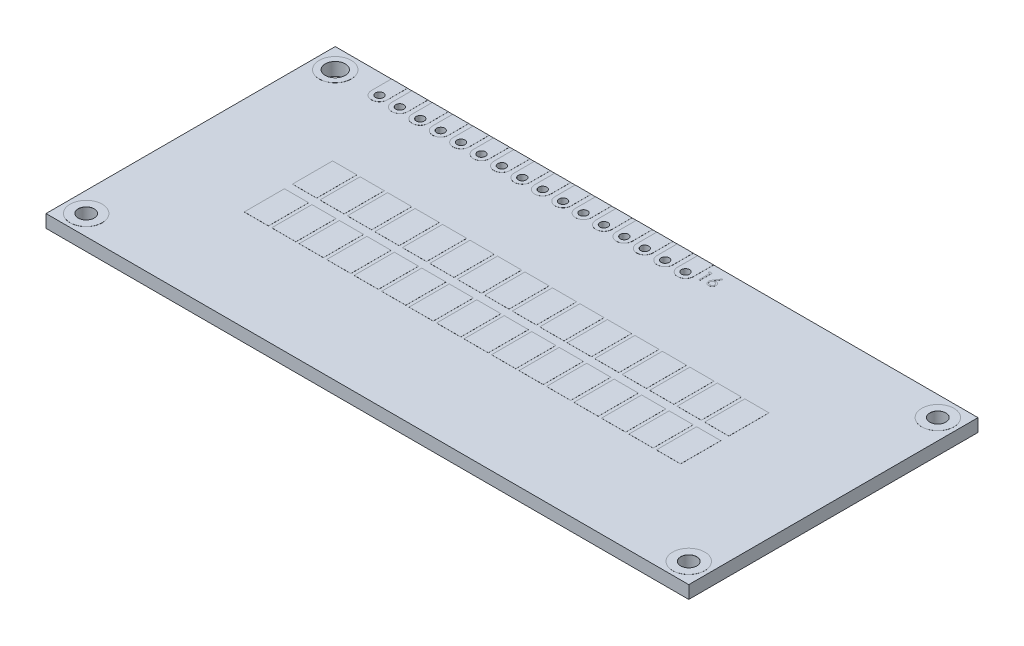
from build123d import *

# Parameters (mm, degrees)
CROQUIS1_W              = 80
CROQUIS1_H              = 36
CROQUIS1_R              = 1.25
CROQUIS1_R_2            = 0.5
SALIENTE_EXTRUIR1_DEPTH = 1.6
CROQUIS2_R              = 2
CROQUIS2_R_2            = 1.25
CROQUIS2_R_3            = 1
CROQUIS2_R_4            = 0.5
CROQUIS2_W              = 3.01
CROQUIS2_H              = 5
SALIENTE_EXTRUIR3_DEPTH = 0.01
SALIENTE_EXTRUIR5_DEPTH = 0.01
CROQUIS6_R              = 7.5
SALIENTE_EXTRUIR6_DEPTH = 2
REDONDEO1_R             = 15


with BuildPart() as part:
    # Croquis1 → Saliente-Extruir1 (new body)
    with BuildSketch(Plane(origin=(0, 0, 0), x_dir=(1, 0, 0), z_dir=(0, 1, 0))):
        Rectangle(CROQUIS1_W, CROQUIS1_H)
        with Locations(Location((-37.5, 15.5, 0), (0, 0, 270))):
            Circle(CROQUIS1_R, mode=Mode.SUBTRACT)
        with Locations(Location((-37.5, -15.5, 0), (0, 0, 270))):
            Circle(CROQUIS1_R, mode=Mode.SUBTRACT)
        with Locations(Location((37.5, -15.5, 0), (0, 0, 270))):
            Circle(CROQUIS1_R, mode=Mode.SUBTRACT)
        with Locations(Location((37.5, 15.5, 0), (0, 0, 270))):
            Circle(CROQUIS1_R, mode=Mode.SUBTRACT)
        with Locations(Location((-32, 15.5, 0), (0, 0, 270))):
            Circle(CROQUIS1_R_2, mode=Mode.SUBTRACT)
        with Locations(Location((-29.46, 15.5, 0), (0, 0, 270))):
            Circle(CROQUIS1_R_2, mode=Mode.SUBTRACT)
        with Locations(Location((-26.92, 15.5, 0), (0, 0, 270))):
            Circle(CROQUIS1_R_2, mode=Mode.SUBTRACT)
        with Locations(Location((-24.38, 15.5, 0), (0, 0, 270))):
            Circle(CROQUIS1_R_2, mode=Mode.SUBTRACT)
        with Locations(Location((-21.84, 15.5, 0), (0, 0, 270))):
            Circle(CROQUIS1_R_2, mode=Mode.SUBTRACT)
        with Locations(Location((-19.3, 15.5, 0), (0, 0, 270))):
            Circle(CROQUIS1_R_2, mode=Mode.SUBTRACT)
        with Locations(Location((-16.76, 15.5, 0), (0, 0, 270))):
            Circle(CROQUIS1_R_2, mode=Mode.SUBTRACT)
        with Locations(Location((-14.22, 15.5, 0), (0, 0, 270))):
            Circle(CROQUIS1_R_2, mode=Mode.SUBTRACT)
        with Locations(Location((-11.68, 15.5, 0), (0, 0, 270))):
            Circle(CROQUIS1_R_2, mode=Mode.SUBTRACT)
        with Locations(Location((-9.14, 15.5, 0), (0, 0, 270))):
            Circle(CROQUIS1_R_2, mode=Mode.SUBTRACT)
        with Locations(Location((-6.6, 15.5, 0), (0, 0, 270))):
            Circle(CROQUIS1_R_2, mode=Mode.SUBTRACT)
        with Locations(Location((-4.06, 15.5, 0), (0, 0, 270))):
            Circle(CROQUIS1_R_2, mode=Mode.SUBTRACT)
        with Locations(Location((-1.52, 15.5, 0), (0, 0, 270))):
            Circle(CROQUIS1_R_2, mode=Mode.SUBTRACT)
        with Locations(Location((1.02, 15.5, 0), (0, 0, 270))):
            Circle(CROQUIS1_R_2, mode=Mode.SUBTRACT)
        with Locations(Location((3.56, 15.5, 0), (0, 0, 270))):
            Circle(CROQUIS1_R_2, mode=Mode.SUBTRACT)
        with Locations(Location((6.1, 15.5, 0), (0, 0, 270))):
            Circle(CROQUIS1_R_2, mode=Mode.SUBTRACT)
    extrude(amount=SALIENTE_EXTRUIR1_DEPTH)

    # Croquis2 → Saliente-Extruir3 (add)
    # profile 1 of 52: a face of its own
    with BuildSketch(Plane(origin=(0, 1.6, 0), x_dir=(1, 0, 0), z_dir=(0, 1, 0))):
        with Locations(Location((-37.5, 15.5, 0), (0, 0, 90))):
            Circle(CROQUIS2_R)
        with Locations(Location((-37.5, 15.5, 0), (0, 0, 270))):
            Circle(CROQUIS2_R_2, mode=Mode.SUBTRACT)
    # profile 2 of 52: a face of its own
    with BuildSketch(Plane(origin=(0, 1.6, 0), x_dir=(1, 0, 0), z_dir=(0, 1, 0))):
        with Locations(Location((-37.5, -15.5, 0), (0, 0, 90))):
            Circle(CROQUIS2_R)
        with Locations(Location((-37.5, -15.5, 0), (0, 0, 90))):
            Circle(CROQUIS2_R_3, mode=Mode.SUBTRACT)
    # profile 3 of 52: a face of its own
    with BuildSketch(Plane(origin=(0, 1.6, 0), x_dir=(1, 0, 0), z_dir=(0, 1, 0))):
        with Locations(Location((37.5, -15.5, 0), (0, 0, 90))):
            Circle(CROQUIS2_R)
        with Locations(Location((37.5, -15.5, 0), (0, 0, 90))):
            Circle(CROQUIS2_R_3, mode=Mode.SUBTRACT)
    # profile 4 of 52: a face of its own
    with BuildSketch(Plane(origin=(0, 1.6, 0), x_dir=(1, 0, 0), z_dir=(0, 1, 0))):
        with Locations(Location((37.5, 15.5, 0), (0, 0, 90))):
            Circle(CROQUIS2_R)
        with Locations(Location((37.5, 15.5, 0), (0, 0, 90))):
            Circle(CROQUIS2_R_3, mode=Mode.SUBTRACT)
    # profile 5 of 52: a face of its own
    with BuildSketch(Plane(origin=(0, 1.6, 0), x_dir=(1, 0, 0), z_dir=(0, 1, 0))):
        with BuildLine():
            Line((-33, 18), (-33, 15.5))
            ThreePointArc((-33, 15.5), (-32, 14.5), (-31, 15.5))
            Line((-31, 15.5), (-31, 18))
            Line((-31, 18), (-33, 18))
        make_face()
        with Locations(Location((-32, 15.5, 0), (0, 0, 270))):
            Circle(CROQUIS2_R_4, mode=Mode.SUBTRACT)
    # profile 6 of 52: a face of its own
    with BuildSketch(Plane(origin=(0, 1.6, 0), x_dir=(1, 0, 0), z_dir=(0, 1, 0))):
        with BuildLine():
            Line((-28.46, 18), (-30.46, 18))
            Line((-30.46, 18), (-30.46, 15.5))
            ThreePointArc((-30.46, 15.5), (-29.46, 14.5), (-28.46, 15.5))
            Line((-28.46, 15.5), (-28.46, 18))
        make_face()
        with Locations(Location((-29.46, 15.5, 0), (0, 0, 270))):
            Circle(CROQUIS2_R_4, mode=Mode.SUBTRACT)
    # profile 7 of 52: a face of its own
    with BuildSketch(Plane(origin=(0, 1.6, 0), x_dir=(1, 0, 0), z_dir=(0, 1, 0))):
        with BuildLine():
            Line((-25.92, 18), (-27.92, 18))
            Line((-27.92, 18), (-27.92, 15.5))
            ThreePointArc((-27.92, 15.5), (-26.92, 14.5), (-25.92, 15.5))
            Line((-25.92, 15.5), (-25.92, 18))
        make_face()
        with Locations(Location((-26.92, 15.5, 0), (0, 0, 270))):
            Circle(CROQUIS2_R_4, mode=Mode.SUBTRACT)
    # profile 8 of 52: a face of its own
    with BuildSketch(Plane(origin=(0, 1.6, 0), x_dir=(1, 0, 0), z_dir=(0, 1, 0))):
        with BuildLine():
            Line((-23.38, 18), (-25.38, 18))
            Line((-25.38, 18), (-25.38, 15.5))
            ThreePointArc((-25.38, 15.5), (-24.38, 14.5), (-23.38, 15.5))
            Line((-23.38, 15.5), (-23.38, 18))
        make_face()
        with Locations(Location((-24.38, 15.5, 0), (0, 0, 270))):
            Circle(CROQUIS2_R_4, mode=Mode.SUBTRACT)
    # profile 9 of 52: a face of its own
    with BuildSketch(Plane(origin=(0, 1.6, 0), x_dir=(1, 0, 0), z_dir=(0, 1, 0))):
        with BuildLine():
            Line((-20.84, 18), (-22.84, 18))
            Line((-22.84, 18), (-22.84, 15.5))
            ThreePointArc((-22.84, 15.5), (-21.84, 14.5), (-20.84, 15.5))
            Line((-20.84, 15.5), (-20.84, 18))
        make_face()
        with Locations(Location((-21.84, 15.5, 0), (0, 0, 270))):
            Circle(CROQUIS2_R_4, mode=Mode.SUBTRACT)
    # profile 10 of 52: a face of its own
    with BuildSketch(Plane(origin=(0, 1.6, 0), x_dir=(1, 0, 0), z_dir=(0, 1, 0))):
        with BuildLine():
            Line((-18.3, 18), (-20.3, 18))
            Line((-20.3, 18), (-20.3, 15.5))
            ThreePointArc((-20.3, 15.5), (-19.3, 14.5), (-18.3, 15.5))
            Line((-18.3, 15.5), (-18.3, 18))
        make_face()
        with Locations(Location((-19.3, 15.5, 0), (0, 0, 270))):
            Circle(CROQUIS2_R_4, mode=Mode.SUBTRACT)
    # profile 11 of 52: a face of its own
    with BuildSketch(Plane(origin=(0, 1.6, 0), x_dir=(1, 0, 0), z_dir=(0, 1, 0))):
        with BuildLine():
            Line((-15.76, 18), (-17.76, 18))
            Line((-17.76, 18), (-17.76, 15.5))
            ThreePointArc((-17.76, 15.5), (-16.76, 14.5), (-15.76, 15.5))
            Line((-15.76, 15.5), (-15.76, 18))
        make_face()
        with Locations(Location((-16.76, 15.5, 0), (0, 0, 270))):
            Circle(CROQUIS2_R_4, mode=Mode.SUBTRACT)
    # profile 12 of 52: a face of its own
    with BuildSketch(Plane(origin=(0, 1.6, 0), x_dir=(1, 0, 0), z_dir=(0, 1, 0))):
        with BuildLine():
            Line((-13.22, 18), (-15.22, 18))
            Line((-15.22, 18), (-15.22, 15.5))
            ThreePointArc((-15.22, 15.5), (-14.22, 14.5), (-13.22, 15.5))
            Line((-13.22, 15.5), (-13.22, 18))
        make_face()
        with Locations(Location((-14.22, 15.5, 0), (0, 0, 270))):
            Circle(CROQUIS2_R_4, mode=Mode.SUBTRACT)
    # profile 13 of 52: a face of its own
    with BuildSketch(Plane(origin=(0, 1.6, 0), x_dir=(1, 0, 0), z_dir=(0, 1, 0))):
        with BuildLine():
            Line((-10.68, 18), (-12.68, 18))
            Line((-12.68, 18), (-12.68, 15.5))
            ThreePointArc((-12.68, 15.5), (-11.68, 14.5), (-10.68, 15.5))
            Line((-10.68, 15.5), (-10.68, 18))
        make_face()
        with Locations(Location((-11.68, 15.5, 0), (0, 0, 270))):
            Circle(CROQUIS2_R_4, mode=Mode.SUBTRACT)
    # profile 14 of 52: a face of its own
    with BuildSketch(Plane(origin=(0, 1.6, 0), x_dir=(1, 0, 0), z_dir=(0, 1, 0))):
        with BuildLine():
            Line((-8.14, 18), (-10.14, 18))
            Line((-10.14, 18), (-10.14, 15.5))
            ThreePointArc((-10.14, 15.5), (-9.14, 14.5), (-8.14, 15.5))
            Line((-8.14, 15.5), (-8.14, 18))
        make_face()
        with Locations(Location((-9.14, 15.5, 0), (0, 0, 270))):
            Circle(CROQUIS2_R_4, mode=Mode.SUBTRACT)
    # profile 15 of 52: a face of its own
    with BuildSketch(Plane(origin=(0, 1.6, 0), x_dir=(1, 0, 0), z_dir=(0, 1, 0))):
        with BuildLine():
            Line((-5.6, 18), (-7.6, 18))
            Line((-7.6, 18), (-7.6, 15.5))
            ThreePointArc((-7.6, 15.5), (-6.6, 14.5), (-5.6, 15.5))
            Line((-5.6, 15.5), (-5.6, 18))
        make_face()
        with Locations(Location((-6.6, 15.5, 0), (0, 0, 270))):
            Circle(CROQUIS2_R_4, mode=Mode.SUBTRACT)
    # profile 16 of 52: a face of its own
    with BuildSketch(Plane(origin=(0, 1.6, 0), x_dir=(1, 0, 0), z_dir=(0, 1, 0))):
        with BuildLine():
            Line((-3.06, 18), (-5.06, 18))
            Line((-5.06, 18), (-5.06, 15.5))
            ThreePointArc((-5.06, 15.5), (-4.06, 14.5), (-3.06, 15.5))
            Line((-3.06, 15.5), (-3.06, 18))
        make_face()
        with Locations(Location((-4.06, 15.5, 0), (0, 0, 270))):
            Circle(CROQUIS2_R_4, mode=Mode.SUBTRACT)
    # profile 17 of 52: a face of its own
    with BuildSketch(Plane(origin=(0, 1.6, 0), x_dir=(1, 0, 0), z_dir=(0, 1, 0))):
        with BuildLine():
            Line((-0.52, 18), (-2.52, 18))
            Line((-2.52, 18), (-2.52, 15.5))
            ThreePointArc((-2.52, 15.5), (-1.52, 14.5), (-0.52, 15.5))
            Line((-0.52, 15.5), (-0.52, 18))
        make_face()
        with Locations(Location((-1.52, 15.5, 0), (0, 0, 270))):
            Circle(CROQUIS2_R_4, mode=Mode.SUBTRACT)
    # profile 18 of 52: a face of its own
    with BuildSketch(Plane(origin=(0, 1.6, 0), x_dir=(1, 0, 0), z_dir=(0, 1, 0))):
        with BuildLine():
            Line((2.02, 18), (0.02, 18))
            Line((0.02, 18), (0.02, 15.5))
            ThreePointArc((0.02, 15.5), (1.02, 14.5), (2.02, 15.5))
            Line((2.02, 15.5), (2.02, 18))
        make_face()
        with Locations(Location((1.02, 15.5, 0), (0, 0, 270))):
            Circle(CROQUIS2_R_4, mode=Mode.SUBTRACT)
    # profile 19 of 52: a face of its own
    with BuildSketch(Plane(origin=(0, 1.6, 0), x_dir=(1, 0, 0), z_dir=(0, 1, 0))):
        with BuildLine():
            Line((4.56, 18), (2.56, 18))
            Line((2.56, 18), (2.56, 15.5))
            ThreePointArc((2.56, 15.5), (3.56, 14.5), (4.56, 15.5))
            Line((4.56, 15.5), (4.56, 18))
        make_face()
        with Locations(Location((3.56, 15.5, 0), (0, 0, 270))):
            Circle(CROQUIS2_R_4, mode=Mode.SUBTRACT)
    # profile 20 of 52: a face of its own
    with BuildSketch(Plane(origin=(0, 1.6, 0), x_dir=(1, 0, 0), z_dir=(0, 1, 0))):
        with BuildLine():
            Line((7.1, 18), (5.1, 18))
            Line((5.1, 18), (5.1, 15.5))
            ThreePointArc((5.1, 15.5), (6.1, 14.5), (7.1, 15.5))
            Line((7.1, 15.5), (7.1, 18))
        make_face()
        with Locations(Location((6.1, 15.5, 0), (0, 0, 270))):
            Circle(CROQUIS2_R_4, mode=Mode.SUBTRACT)
    # profile 21 of 52: a face of its own
    with BuildSketch(Plane(origin=(0, 1.6, 0), x_dir=(1, 0, 0), z_dir=(0, 1, 0))):
        with Locations((-22.9, 3)):
            Rectangle(CROQUIS2_W, CROQUIS2_H)
    # profile 22 of 52: a face of its own
    with BuildSketch(Plane(origin=(0, 1.6, 0), x_dir=(1, 0, 0), z_dir=(0, 1, 0))):
        with Locations((-26.32, 3)):
            Rectangle(CROQUIS2_W, CROQUIS2_H)
    # profile 23 of 52: a face of its own
    with BuildSketch(Plane(origin=(0, 1.6, 0), x_dir=(1, 0, 0), z_dir=(0, 1, 0))):
        with Locations((-19.48, 3)):
            Rectangle(CROQUIS2_W, CROQUIS2_H)
    # profile 24 of 52: a face of its own
    with BuildSketch(Plane(origin=(0, 1.6, 0), x_dir=(1, 0, 0), z_dir=(0, 1, 0))):
        with Locations((-16.06, 3)):
            Rectangle(CROQUIS2_W, CROQUIS2_H)
    # profile 25 of 52: a face of its own
    with BuildSketch(Plane(origin=(0, 1.6, 0), x_dir=(1, 0, 0), z_dir=(0, 1, 0))):
        with Locations((-12.64, 3)):
            Rectangle(CROQUIS2_W, CROQUIS2_H)
    # profile 26 of 52: a face of its own
    with BuildSketch(Plane(origin=(0, 1.6, 0), x_dir=(1, 0, 0), z_dir=(0, 1, 0))):
        with Locations((-9.22, 3)):
            Rectangle(CROQUIS2_W, CROQUIS2_H)
    # profile 27 of 52: a face of its own
    with BuildSketch(Plane(origin=(0, 1.6, 0), x_dir=(1, 0, 0), z_dir=(0, 1, 0))):
        with Locations((-5.8, 3)):
            Rectangle(CROQUIS2_W, CROQUIS2_H)
    # profile 28 of 52: a face of its own
    with BuildSketch(Plane(origin=(0, 1.6, 0), x_dir=(1, 0, 0), z_dir=(0, 1, 0))):
        with Locations((-2.38, 3)):
            Rectangle(CROQUIS2_W, CROQUIS2_H)
    # profile 29 of 52: a face of its own
    with BuildSketch(Plane(origin=(0, 1.6, 0), x_dir=(1, 0, 0), z_dir=(0, 1, 0))):
        with Locations((1.04, 3)):
            Rectangle(CROQUIS2_W, CROQUIS2_H)
    # profile 30 of 52: a face of its own
    with BuildSketch(Plane(origin=(0, 1.6, 0), x_dir=(1, 0, 0), z_dir=(0, 1, 0))):
        with Locations((4.46, 3)):
            Rectangle(CROQUIS2_W, CROQUIS2_H)
    # profile 31 of 52: a face of its own
    with BuildSketch(Plane(origin=(0, 1.6, 0), x_dir=(1, 0, 0), z_dir=(0, 1, 0))):
        with Locations((7.88, 3)):
            Rectangle(CROQUIS2_W, CROQUIS2_H)
    # profile 32 of 52: a face of its own
    with BuildSketch(Plane(origin=(0, 1.6, 0), x_dir=(1, 0, 0), z_dir=(0, 1, 0))):
        with Locations((11.3, 3)):
            Rectangle(CROQUIS2_W, CROQUIS2_H)
    # profile 33 of 52: a face of its own
    with BuildSketch(Plane(origin=(0, 1.6, 0), x_dir=(1, 0, 0), z_dir=(0, 1, 0))):
        with Locations((14.72, 3)):
            Rectangle(CROQUIS2_W, CROQUIS2_H)
    # profile 34 of 52: a face of its own
    with BuildSketch(Plane(origin=(0, 1.6, 0), x_dir=(1, 0, 0), z_dir=(0, 1, 0))):
        with Locations((18.14, 3)):
            Rectangle(CROQUIS2_W, CROQUIS2_H)
    # profile 35 of 52: a face of its own
    with BuildSketch(Plane(origin=(0, 1.6, 0), x_dir=(1, 0, 0), z_dir=(0, 1, 0))):
        with Locations((21.56, 3)):
            Rectangle(CROQUIS2_W, CROQUIS2_H)
    # profile 36 of 52: a face of its own
    with BuildSketch(Plane(origin=(0, 1.6, 0), x_dir=(1, 0, 0), z_dir=(0, 1, 0))):
        with Locations((24.98, 3)):
            Rectangle(CROQUIS2_W, CROQUIS2_H)
    # profile 37 of 52: a face of its own
    with BuildSketch(Plane(origin=(0, 1.6, 0), x_dir=(1, 0, 0), z_dir=(0, 1, 0))):
        with Locations((-26.32, -3)):
            Rectangle(CROQUIS2_W, CROQUIS2_H)
    # profile 38 of 52: a face of its own
    with BuildSketch(Plane(origin=(0, 1.6, 0), x_dir=(1, 0, 0), z_dir=(0, 1, 0))):
        with Locations((-22.9, -3)):
            Rectangle(CROQUIS2_W, CROQUIS2_H)
    # profile 39 of 52: a face of its own
    with BuildSketch(Plane(origin=(0, 1.6, 0), x_dir=(1, 0, 0), z_dir=(0, 1, 0))):
        with Locations((-19.48, -3)):
            Rectangle(CROQUIS2_W, CROQUIS2_H)
    # profile 40 of 52: a face of its own
    with BuildSketch(Plane(origin=(0, 1.6, 0), x_dir=(1, 0, 0), z_dir=(0, 1, 0))):
        with Locations((-16.06, -3)):
            Rectangle(CROQUIS2_W, CROQUIS2_H)
    # profile 41 of 52: a face of its own
    with BuildSketch(Plane(origin=(0, 1.6, 0), x_dir=(1, 0, 0), z_dir=(0, 1, 0))):
        with Locations((-12.64, -3)):
            Rectangle(CROQUIS2_W, CROQUIS2_H)
    # profile 42 of 52: a face of its own
    with BuildSketch(Plane(origin=(0, 1.6, 0), x_dir=(1, 0, 0), z_dir=(0, 1, 0))):
        with Locations((-9.22, -3)):
            Rectangle(CROQUIS2_W, CROQUIS2_H)
    # profile 43 of 52: a face of its own
    with BuildSketch(Plane(origin=(0, 1.6, 0), x_dir=(1, 0, 0), z_dir=(0, 1, 0))):
        with Locations((-5.8, -3)):
            Rectangle(CROQUIS2_W, CROQUIS2_H)
    # profile 44 of 52: a face of its own
    with BuildSketch(Plane(origin=(0, 1.6, 0), x_dir=(1, 0, 0), z_dir=(0, 1, 0))):
        with Locations((-2.38, -3)):
            Rectangle(CROQUIS2_W, CROQUIS2_H)
    # profile 45 of 52: a face of its own
    with BuildSketch(Plane(origin=(0, 1.6, 0), x_dir=(1, 0, 0), z_dir=(0, 1, 0))):
        with Locations((1.04, -3)):
            Rectangle(CROQUIS2_W, CROQUIS2_H)
    # profile 46 of 52: a face of its own
    with BuildSketch(Plane(origin=(0, 1.6, 0), x_dir=(1, 0, 0), z_dir=(0, 1, 0))):
        with Locations((4.46, -3)):
            Rectangle(CROQUIS2_W, CROQUIS2_H)
    # profile 47 of 52: a face of its own
    with BuildSketch(Plane(origin=(0, 1.6, 0), x_dir=(1, 0, 0), z_dir=(0, 1, 0))):
        with Locations((7.88, -3)):
            Rectangle(CROQUIS2_W, CROQUIS2_H)
    # profile 48 of 52: a face of its own
    with BuildSketch(Plane(origin=(0, 1.6, 0), x_dir=(1, 0, 0), z_dir=(0, 1, 0))):
        with Locations((11.3, -3)):
            Rectangle(CROQUIS2_W, CROQUIS2_H)
    # profile 49 of 52: a face of its own
    with BuildSketch(Plane(origin=(0, 1.6, 0), x_dir=(1, 0, 0), z_dir=(0, 1, 0))):
        with Locations((14.72, -3)):
            Rectangle(CROQUIS2_W, CROQUIS2_H)
    # profile 50 of 52: a face of its own
    with BuildSketch(Plane(origin=(0, 1.6, 0), x_dir=(1, 0, 0), z_dir=(0, 1, 0))):
        with Locations((18.14, -3)):
            Rectangle(CROQUIS2_W, CROQUIS2_H)
    # profile 51 of 52: a face of its own
    with BuildSketch(Plane(origin=(0, 1.6, 0), x_dir=(1, 0, 0), z_dir=(0, 1, 0))):
        with Locations((21.56, -3)):
            Rectangle(CROQUIS2_W, CROQUIS2_H)
    # profile 52 of 52: a face of its own
    with BuildSketch(Plane(origin=(0, 1.6, 0), x_dir=(1, 0, 0), z_dir=(0, 1, 0))):
        with Locations((24.98, -3)):
            Rectangle(CROQUIS2_W, CROQUIS2_H)
    extrude(amount=SALIENTE_EXTRUIR3_DEPTH)

    # Croquis5 → Saliente-Extruir5 (add)
    # profile 1 of 2: a face of its own
    with BuildSketch(Plane(origin=(0, 1.6, 0), x_dir=(1, 0, 0), z_dir=(0, 1, 0))):
        Polygon((7.630348558, 17), (7.907692308, 17), (7.907692308, 15.5), (7.773076923, 15.5), (7.773076923, 16.846153846), (7.542307692, 16.846153846), align=None)
    # profile 2 of 2: a face of its own
    with BuildSketch(Plane(origin=(0, 1.6, 0), x_dir=(1, 0, 0), z_dir=(0, 1, 0))):
        with BuildLine():
            Line((9.157692308, 17.038461538), (9.261358173, 16.95703125))
            Line((9.261358173, 16.95703125), (8.865024038, 16.350961538))
            add(Edge.make_bspline(
                [(8.865024038, 16.350961538), (8.8914113, 16.355167479), (8.942882637, 16.363371641), (8.994982308, 16.364725046), (9.020372596, 16.365384615)],
                knots=[0, 0, 0, 0, 1.025318673, 2, 2, 2, 2], degree=3))
            add(Edge.make_bspline(
                [(9.020372596, 16.365384615), (9.035617952, 16.364974853), (9.06562798, 16.364168249), (9.109688039, 16.357960884), (9.152026154, 16.348178693), (9.192466845, 16.333919155), (9.231155266, 16.31570386), (9.268313436, 16.293872916), (9.303242868, 16.267299053), (9.336393374, 16.237614072), (9.366490701, 16.204735364), (9.393137582, 16.169849077), (9.415520493, 16.132991557), (9.433680745, 16.094181471), (9.447782836, 16.053478646), (9.458063255, 16.010935157), (9.464140224, 15.966521669), (9.464965434, 15.936316737), (9.465384615, 15.920973558)],
                knots=[0, 0, 0, 0, 1.04369286, 2.054478336, 3.041073146, 4.015093852, 4.984733326, 5.965804835, 6.960378782, 7.985147595, 9.009457201, 10.008161701, 10.986880575, 11.956520048, 12.937015923, 13.931873656, 14.949455224, 16, 16, 16, 16], degree=3))
            add(Edge.make_bspline(
                [(9.465384615, 15.920973558), (9.464774713, 15.899982256), (9.46357457, 15.858676342), (9.451615801, 15.798514896), (9.433033096, 15.741200961), (9.406471298, 15.687649602), (9.373478848, 15.637934215), (9.333245594, 15.593883301), (9.287198385, 15.554596142), (9.235132614, 15.521743306), (9.179099915, 15.494913427), (9.120234773, 15.475642609), (9.059108854, 15.463778265), (9.017621164, 15.462290863), (8.996634615, 15.461538462)],
                knots=[0, 0, 0, 0, 1.031375318, 2.029502543, 3.004789286, 3.987476834, 4.960371455, 5.9300674, 6.912260825, 7.929083631, 8.949397511, 9.960523116, 10.96833055, 12, 12, 12, 12], degree=3))
            add(Edge.make_bspline(
                [(8.996634615, 15.461538462), (8.976450315, 15.462193407), (8.93646875, 15.463490739), (8.877654696, 15.475047569), (8.821141974, 15.493779185), (8.767326525, 15.519585304), (8.717474834, 15.55218154), (8.672875275, 15.591422517), (8.633750229, 15.63646943), (8.601189677, 15.687315293), (8.575364506, 15.741953846), (8.555997396, 15.798926914), (8.54468472, 15.858026906), (8.54310391, 15.898090251), (8.542307692, 15.918269231)],
                knots=[0, 0, 0, 0, 1.012016664, 2.004627821, 2.994792927, 3.992885782, 4.990978636, 5.973936114, 6.964471063, 7.975201453, 8.993600317, 9.990122807, 10.98767138, 12, 12, 12, 12], degree=3))
            add(Edge.make_bspline(
                [(8.542307692, 15.918269231), (8.542814026, 15.933716909), (8.543847862, 15.965258117), (8.551066458, 16.013028415), (8.562665656, 16.06190745), (8.575655762, 16.103373533), (8.589381023, 16.137342757), (8.60080354, 16.164729967), (8.615020967, 16.192913284), (8.630180987, 16.222859128), (8.647648217, 16.253795742), (8.666640638, 16.286240172), (8.687683346, 16.319676427), (8.702434844, 16.342366796), (8.709975962, 16.353966346)],
                knots=[0, 0, 0, 0, 1.173818275, 2.396712641, 3.66331629, 4.989737886, 5.693666774, 6.447286557, 7.243889047, 8.091586357, 8.998013824, 9.943181721, 10.948533338, 12, 12, 12, 12], degree=3))
            Line((8.709975962, 16.353966346), (9.157692308, 17.038461538))
        make_face()
        with BuildLine():
            add(Edge.make_bspline(
                [(8.992127404, 16.211538462), (8.980700727, 16.211205014), (8.958381109, 16.210553695), (8.925635074, 16.206771444), (8.894643681, 16.199648987), (8.864996338, 16.190577702), (8.837247322, 16.178104962), (8.811194962, 16.162954191), (8.786738512, 16.145116544), (8.764134132, 16.124844725), (8.743639991, 16.102649853), (8.725990935, 16.078877201), (8.710767049, 16.054099685), (8.698389127, 16.028110281), (8.688750523, 16.000918924), (8.681778415, 15.972650675), (8.677898236, 15.943115972), (8.677252708, 15.923087757), (8.676923077, 15.912860577)],
                knots=[0, 0, 0, 0, 1.129588631, 2.206414736, 3.251139165, 4.268635594, 5.265702196, 6.250456724, 7.242448911, 8.251968645, 9.246821453, 10.222880186, 11.173611482, 12.116736599, 13.062300278, 14.020270554, 14.989073742, 16, 16, 16, 16], degree=3))
            add(Edge.make_bspline(
                [(8.676923077, 15.912860577), (8.677191518, 15.902724871), (8.67771789, 15.882850261), (8.682497455, 15.853562042), (8.689798205, 15.825377081), (8.700658375, 15.798440681), (8.713612755, 15.772342259), (8.730715037, 15.748027137), (8.749665088, 15.724018536), (8.772316774, 15.702160762), (8.796626787, 15.681822209), (8.82259873, 15.664044957), (8.849667285, 15.648836597), (8.878197894, 15.636917555), (8.907785773, 15.627135718), (8.938677439, 15.620252227), (8.970894377, 15.616360573), (8.992718065, 15.615714204), (9.003846154, 15.615384615)],
                knots=[0, 0, 0, 0, 0.989467248, 1.94019797, 2.891935182, 3.827694429, 4.772920941, 5.730924762, 6.725747692, 7.756678648, 8.79901574, 9.819492441, 10.826891316, 11.826466727, 12.835195252, 13.867842842, 14.912794438, 16, 16, 16, 16], degree=3))
            add(Edge.make_bspline(
                [(9.003846154, 15.615384615), (9.014974225, 15.61571423), (9.036797877, 15.61636065), (9.069015074, 15.620251936), (9.099905782, 15.627136785), (9.129497143, 15.636913687), (9.158014899, 15.648850948), (9.185059779, 15.663950342), (9.210786105, 15.681931536), (9.235112077, 15.702126005), (9.257669479, 15.724142941), (9.277074027, 15.747812823), (9.293652555, 15.772538778), (9.30712435, 15.798337873), (9.317864903, 15.825393368), (9.325202675, 15.853557678), (9.32997237, 15.882851404), (9.330500098, 15.902725257), (9.330769231, 15.912860577)],
                knots=[0, 0, 0, 0, 1.087397944, 2.132534446, 3.165364764, 4.174271784, 5.174024072, 6.181601208, 7.194203697, 8.236725232, 9.267838612, 10.269026844, 11.221737037, 12.171628256, 13.107553087, 14.05945871, 15.010357665, 16, 16, 16, 16], degree=3))
            add(Edge.make_bspline(
                [(9.330769231, 15.912860577), (9.330533391, 15.923101099), (9.330070514, 15.943199913), (9.324835107, 15.972637463), (9.31757409, 16.001062552), (9.306609934, 16.02829653), (9.292365701, 16.054231927), (9.275015669, 16.078999756), (9.254944567, 16.102789905), (9.231759908, 16.124888252), (9.206521236, 16.145094142), (9.179685985, 16.162931095), (9.151611139, 16.177984656), (9.122325164, 16.190544843), (9.0914925, 16.199608903), (9.059610926, 16.206746007), (9.026272679, 16.210544015), (9.003654133, 16.211202757), (8.992127404, 16.211538462)],
                knots=[0, 0, 0, 0, 0.978206639, 1.919901502, 2.851605144, 3.780102724, 4.718870031, 5.675451981, 6.667674623, 7.690630536, 8.733308323, 9.756129687, 10.767539656, 11.776269907, 12.797430371, 13.836405707, 14.897401972, 16, 16, 16, 16], degree=3))
        make_face(mode=Mode.SUBTRACT)
    extrude(amount=SALIENTE_EXTRUIR5_DEPTH)

    # Croquis6 → Saliente-Extruir6 (add)
    with BuildSketch(Plane.XZ):
        with Locations(Location((0, 0, 0), (0, 0, 270))):
            Circle(CROQUIS6_R)
    extrude(amount=SALIENTE_EXTRUIR6_DEPTH)

    # Redondeo1
    # the kernel refuses this fillet: 15 mm, written as the material it takes off along each edge
    with BuildSketch(Plane(origin=(0, -2, 0), x_dir=(0, 0, -1), z_dir=(-1, 0, 0))) as redondeo1_piece_1:
        with BuildLine():
            CenterArc((0.016685226, -15), REDONDEO1_R, 60.073565133, 29.926434867)
            Line((0.016685226, 0), (0.016685226, 0.3))
            Line((0.016685226, 0.3), (7.5, 0.3))
            Line((7.5, 0.3), (7.8, 0))
            ThreePointArc((7.8, 0), (7.8, -1), (7.649666295, -1.74))
            Line((7.649666295, -1.74), (7.5, -2))
        make_face()
    revolve(axis=Axis((0, -2, 0), (0, -1, 0)), mode=Mode.SUBTRACT)


solid = part.part
